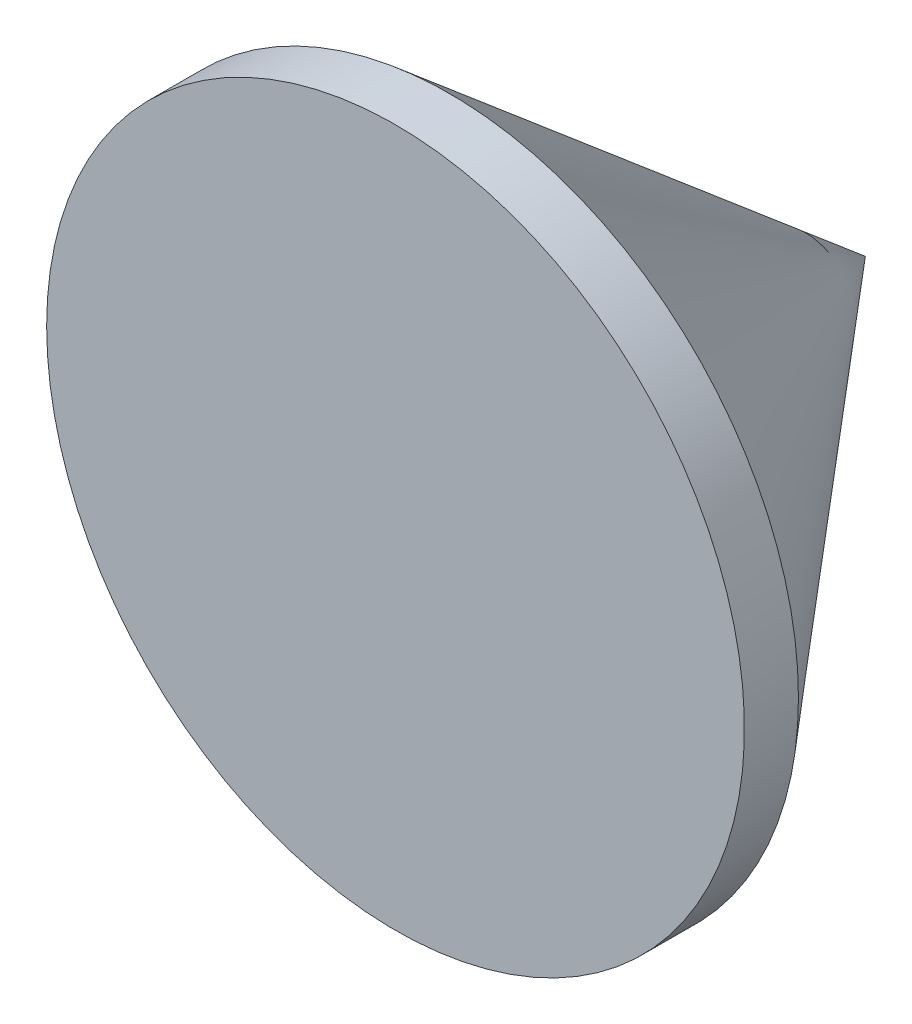
from build123d import *


with BuildPart() as part:
    # Sketch2 → Revolve1 (revolve)
    with BuildSketch(Plane(origin=(0, 0, 0), x_dir=(1, 0, 0), z_dir=(0, 1, 0))):
        Polygon((323, 0), (323, 50), (0, 434.936410408), (0, 0), align=None)
    revolve(axis=Axis((0, 0, -434.936410408), (0, 0, 1)))


solid = part.part
